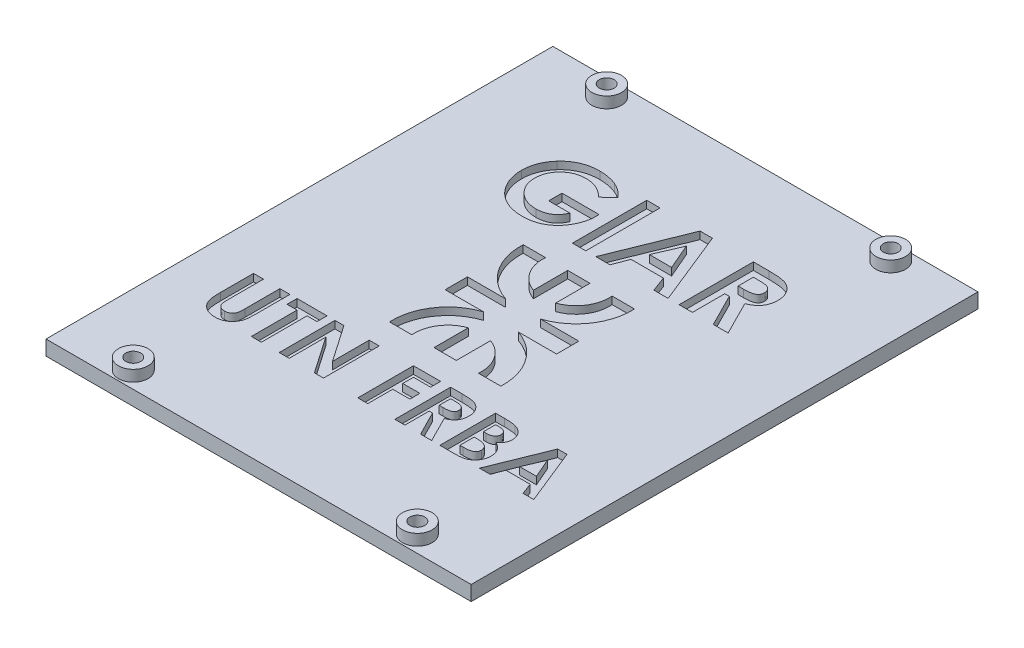
from build123d import *

# Parameters (mm, degrees)
SKETCH2_W           = 114.5
SKETCH2_H           = 136.5
SKETCH2_R           = 2
BOSS_EXTRUDE1_DEPTH = 4
CUT_EXTRUDE1_DEPTH  = 2
SKETCH4_W           = 3.58974359
SKETCH4_H           = 20
CUT_EXTRUDE2_DEPTH  = 2
SKETCH5_R           = 4
SKETCH5_R_2         = 2
BOSS_EXTRUDE2_DEPTH = 3


with BuildPart() as part:
    # Sketch2 → Boss-Extrude1 (new body)
    with BuildSketch(Plane(origin=(0, 0, 0), x_dir=(1, 0, 0), z_dir=(0, 1, 0))):
        Rectangle(SKETCH2_W, SKETCH2_H)
        with Locations((-38.25, 63.75)):
            Circle(SKETCH2_R, mode=Mode.SUBTRACT)
        with Locations((-38.25, -63.75)):
            Circle(SKETCH2_R, mode=Mode.SUBTRACT)
        with Locations((38.25, -63.75)):
            Circle(SKETCH2_R, mode=Mode.SUBTRACT)
        with Locations((38.25, 63.75)):
            Circle(SKETCH2_R, mode=Mode.SUBTRACT)
    extrude(amount=BOSS_EXTRUDE1_DEPTH)

    # Sketch3 → Cut-Extrude1 (cut)
    with BuildSketch(Plane(origin=(0, 4, 0), x_dir=(1, 0, 0), z_dir=(0, 1, 0))):
        with BuildLine():
            Line((-15, 3), (-15, -3))
            Line((-15, -3), (-4.683748499, -3))
            ThreePointArc((-4.683748499, -3), (-12.36640312, -8.760472694), (-14.981238267, -18))
            Line((-14.981238267, -18), (-8.968695557, -18))
            ThreePointArc((-8.968695557, -18), (-7.558771319, -12.364820766), (-3, -8.764718626))
            Line((-3, -8.764718626), (-3, -18))
            Line((-3, -18), (3, -18))
            Line((3, -18), (3, -8.764718626))
            ThreePointArc((3, -8.764718626), (7.558771319, -12.364820766), (8.968695557, -18))
            Line((8.968695557, -18), (14.981238267, -18))
            ThreePointArc((14.981238267, -18), (12.36640312, -8.760472694), (4.683748499, -3))
            Line((4.683748499, -3), (15, -3))
            Line((15, -3), (15, 3))
            Line((15, 3), (4.683748499, 3))
            ThreePointArc((4.683748499, 3), (12.36640312, 8.760472694), (14.981238267, 18))
            Line((14.981238267, 18), (8.968695557, 18))
            ThreePointArc((8.968695557, 18), (7.558771319, 12.364820766), (3, 8.764718626))
            Line((3, 8.764718626), (3, 18))
            Line((3, 18), (0, 18))
            Line((0, 18), (-3, 18))
            Line((-3, 18), (-3, 8.764718626))
            ThreePointArc((-3, 8.764718626), (-7.558771319, 12.364820766), (-8.968695557, 18))
            Line((-8.968695557, 18), (-14.981238267, 18))
            ThreePointArc((-14.981238267, 18), (-12.36640312, 8.760472694), (-4.683748499, 3))
            Line((-4.683748499, 3), (-15, 3))
        make_face()
    extrude(amount=-CUT_EXTRUDE1_DEPTH, mode=Mode.SUBTRACT)

    # Sketch4 → Cut-Extrude2 (cut)
    # profile 1 of 11: a face of its own
    with BuildSketch(Plane(origin=(0, 4, 4), x_dir=(1, 0, 0), z_dir=(0, 1, 0))):
        with BuildLine():
            Line((-13.209134615, 45.818910256), (-15.925480769, 43.21875))
            add(Edge.make_bspline(
                [(-15.925480769, 43.21875), (-16.140538634, 43.434065542), (-16.56251767, 43.856550183), (-17.252611595, 44.406442978), (-17.967339464, 44.873960563), (-18.709053733, 45.258386223), (-19.478787615, 45.556580188), (-20.275022094, 45.769887872), (-21.099052543, 45.896404274), (-21.656884374, 45.914116139), (-21.939102564, 45.923076923)],
                knots=[0, 0, 0, 0, 1.075575784, 2.110457258, 3.113929901, 4.09197124, 5.059417775, 6.02750972, 7.002078037, 8, 8, 8, 8], degree=3))
            add(Edge.make_bspline(
                [(-21.939102564, 45.923076923), (-22.183777106, 45.916798142), (-22.664217018, 45.904469206), (-23.370177196, 45.810844105), (-24.04476539, 45.654447585), (-24.691168634, 45.43778632), (-25.305440412, 45.155841537), (-25.891139928, 44.812964722), (-26.444662783, 44.40653284), (-26.961650383, 43.944250426), (-27.432369257, 43.439531365), (-27.843331689, 42.899303498), (-28.193383392, 42.333636215), (-28.481547336, 41.739635478), (-28.700808761, 41.11821296), (-28.857332726, 40.469819783), (-28.956686522, 39.796340266), (-28.968417237, 39.336885564), (-28.974358974, 39.104166667)],
                knots=[0, 0, 0, 0, 1.075001177, 2.110859044, 3.123021556, 4.114053297, 5.101481495, 6.087880186, 7.091499647, 8.114004866, 9.131394192, 10.11971144, 11.092043119, 12.050101265, 13.015322563, 13.981809771, 14.977764287, 16, 16, 16, 16], degree=3))
            add(Edge.make_bspline(
                [(-28.974358974, 39.104166667), (-28.968816806, 38.863393056), (-28.957897976, 38.389036082), (-28.853010267, 37.692896831), (-28.691412693, 37.023160707), (-28.454876933, 36.384796998), (-28.163773046, 35.769061012), (-27.794605356, 35.187880141), (-27.364118887, 34.632379115), (-26.873082857, 34.112229527), (-26.338962464, 33.632776788), (-25.760492701, 33.219188514), (-25.155274163, 32.862351109), (-24.513538596, 32.57974742), (-23.846424631, 32.352847616), (-23.147165815, 32.192863783), (-22.41733671, 32.094714256), (-21.919380892, 32.082912505), (-21.666666667, 32.076923077)],
                knots=[0, 0, 0, 0, 1.022067601, 2.013613092, 2.983553406, 3.943623673, 4.90013463, 5.87121881, 6.861774014, 7.881098904, 8.905697761, 9.905387765, 10.89678721, 11.884561068, 12.87834324, 13.885584958, 14.926927371, 16, 16, 16, 16], degree=3))
            add(Edge.make_bspline(
                [(-21.666666667, 32.076923077), (-21.502285422, 32.07840626), (-21.179568462, 32.08131808), (-20.706197677, 32.128585096), (-20.252822164, 32.19615879), (-19.817686125, 32.285618337), (-19.405183266, 32.412219649), (-19.009602202, 32.560264294), (-18.63326069, 32.734986493), (-18.278199215, 32.942414489), (-17.939133432, 33.174915917), (-17.619237062, 33.440946992), (-17.312898747, 33.734509694), (-17.02369801, 34.059190303), (-16.75652966, 34.417891852), (-16.502834297, 34.804022719), (-16.265516693, 35.221415018), (-16.125291982, 35.516156317), (-16.053685897, 35.666666667)],
                knots=[0, 0, 0, 0, 1.109579412, 2.178351274, 3.208885622, 4.204702371, 5.174744997, 6.119429583, 7.05542196, 7.97267548, 8.893247984, 9.828544973, 10.778894627, 11.756245826, 12.760884819, 13.796418446, 14.874735809, 16, 16, 16, 16], degree=3))
            Line((-16.053685897, 35.666666667), (-21.794871795, 35.666666667))
            Line((-21.794871795, 35.666666667), (-21.794871795, 39.256410256))
            Line((-21.794871795, 39.256410256), (-11.822916667, 39.256410256))
            Line((-11.822916667, 39.256410256), (-11.794871795, 38.403044872))
            add(Edge.make_bspline(
                [(-11.794871795, 38.403044872), (-11.798475352, 38.183878989), (-11.805676036, 37.745938343), (-11.871482733, 37.093919328), (-11.980490525, 36.450547993), (-12.129514611, 35.816470524), (-12.316279489, 35.188576544), (-12.554463172, 34.572878661), (-12.833374809, 33.965201415), (-13.14587551, 33.368126966), (-13.497036385, 32.795217798), (-13.875112629, 32.252748445), (-14.274714507, 31.741657803), (-14.704533196, 31.269066647), (-15.157875711, 30.831005), (-15.635634462, 30.42915814), (-16.139499256, 30.063186054), (-16.666800922, 29.729997114), (-17.22054295, 29.437976667), (-17.797680867, 29.183957618), (-18.397343275, 28.968224603), (-19.021078359, 28.791370462), (-19.667658767, 28.654913422), (-20.337098348, 28.56134465), (-21.029764767, 28.497763619), (-21.499585747, 28.490750183), (-21.738782051, 28.487179487)],
                knots=[0, 0, 0, 0, 1.006889344, 2.011981806, 3.007738725, 4.003571281, 5.003404394, 6.015442001, 7.03424805, 8.074616296, 9.110249922, 10.119753985, 11.111721717, 12.089233633, 13.052717867, 14.006597561, 14.955430184, 15.912305663, 16.870361111, 17.829300583, 18.807640451, 19.796414044, 20.806216501, 21.841577364, 22.90109906, 24, 24, 24, 24], degree=3))
            add(Edge.make_bspline(
                [(-21.738782051, 28.487179487), (-21.99398829, 28.490705616), (-22.499883174, 28.497695454), (-23.247916563, 28.563160047), (-23.974249037, 28.671205132), (-24.679061761, 28.820735838), (-25.363991169, 29.006838746), (-26.027860445, 29.240441918), (-26.669311799, 29.518320278), (-27.290266076, 29.833115501), (-27.882786803, 30.190120704), (-28.445546048, 30.583075759), (-28.975472162, 31.014508365), (-29.477993232, 31.47719625), (-29.941368425, 31.982512324), (-30.382865921, 32.514076841), (-30.781096678, 33.091385468), (-31.153183438, 33.695721691), (-31.483748288, 34.326832259), (-31.772832002, 34.973044458), (-32.019362429, 35.630616715), (-32.21375763, 36.302610909), (-32.371588328, 36.984341331), (-32.484519153, 37.678772671), (-32.548296467, 38.385818001), (-32.558810475, 38.860989088), (-32.564102564, 39.100160256)],
                knots=[0, 0, 0, 0, 1.084149091, 2.14910686, 3.187506334, 4.202448172, 5.208724393, 6.201130722, 7.189831603, 8.176984443, 9.156919086, 10.126598231, 11.090766514, 12.05840148, 13.026036446, 14.001772938, 14.991905635, 16.003017641, 17.015720547, 18.016462227, 19.009322657, 19.99686681, 20.986544154, 21.980959929, 22.983742515, 24, 24, 24, 24], degree=3))
            add(Edge.make_bspline(
                [(-32.564102564, 39.100160256), (-32.557015327, 39.42644084), (-32.543020135, 40.070748258), (-32.41340342, 41.019817171), (-32.211350272, 41.937946648), (-31.921383662, 42.821792922), (-31.549288027, 43.672573502), (-31.10033444, 44.492285636), (-30.564770654, 45.280058041), (-30.1502075, 45.76779857), (-29.939903846, 46.015224359)],
                knots=[0, 0, 0, 0, 1.034044851, 2.041932006, 3.031217818, 4.011390712, 4.986069675, 5.97149666, 6.970960976, 8, 8, 8, 8], degree=3))
            add(Edge.make_bspline(
                [(-29.939903846, 46.015224359), (-29.809328362, 46.158367677), (-29.550137991, 46.442505011), (-29.135822654, 46.837319617), (-28.711000164, 47.208459953), (-28.269786662, 47.548056221), (-27.814501525, 47.863542347), (-27.343834363, 48.149004292), (-26.860254187, 48.413531314), (-26.359989657, 48.643615663), (-25.845659727, 48.849905474), (-25.314986511, 49.02445566), (-24.771944641, 49.179065637), (-24.211725465, 49.296684175), (-23.639988532, 49.394627918), (-23.052675462, 49.460274943), (-22.451386719, 49.50838954), (-22.044705255, 49.511331839), (-21.838942308, 49.512820513)],
                knots=[0, 0, 0, 0, 1.020590567, 2.025856924, 3.013483481, 3.991664875, 4.957826714, 5.930500614, 6.890802512, 7.860442893, 8.829981142, 9.809047939, 10.802672283, 11.803273349, 12.823572789, 13.857849586, 14.916166035, 16, 16, 16, 16], degree=3))
            add(Edge.make_bspline(
                [(-21.838942308, 49.512820513), (-21.623853223, 49.509503469), (-21.195904924, 49.50290377), (-20.559616672, 49.457238161), (-19.932170072, 49.38678689), (-19.316209245, 49.28110596), (-18.709667024, 49.150779378), (-18.115683016, 48.983798769), (-17.530382211, 48.794078719), (-17.149353604, 48.642819879), (-16.959134615, 48.567307692)],
                knots=[0, 0, 0, 0, 1.03180557, 2.052914215, 3.058998889, 4.059601663, 5.049854447, 6.033765722, 7.018406786, 8, 8, 8, 8], degree=3))
            add(Edge.make_bspline(
                [(-16.959134615, 48.567307692), (-16.799088867, 48.497520839), (-16.473560242, 48.355576311), (-15.999956214, 48.095882139), (-15.525195042, 47.807981343), (-15.05439964, 47.481347603), (-14.588287368, 47.116591875), (-14.121991519, 46.719475414), (-13.660272207, 46.285367615), (-13.36146133, 45.976409693), (-13.209134615, 45.818910256)],
                knots=[0, 0, 0, 0, 0.894392155, 1.819168899, 2.76525314, 3.739198753, 4.75366411, 5.797420238, 6.877176959, 8, 8, 8, 8], degree=3))
        make_face()
    # profile 2 of 11: a face of its own
    with BuildSketch(Plane(origin=(0, 4, 4), x_dir=(1, 0, 0), z_dir=(0, 1, 0))):
        with Locations((-6.923076923, 39)):
            Rectangle(SKETCH4_W, SKETCH4_H)
    # profile 3 of 11: a face of its own
    with BuildSketch(Plane(origin=(0, 4, 4), x_dir=(1, 0, 0), z_dir=(0, 1, 0))):
        Polygon((5.645032051, 49), (8.974358974, 49), (17.051282051, 29), (13.217147436, 29), (11.662660256, 33.102564103), (2.948717949, 33.102564103), (1.394230769, 29), (-2.435897436, 29), align=None)
        Polygon((7.307692308, 43.635416667), (4.310897436, 36.692307692), (10.304487179, 36.692307692), align=None, mode=Mode.SUBTRACT)
    # profile 4 of 11: a face of its own
    with BuildSketch(Plane(origin=(0, 4, 4), x_dir=(1, 0, 0), z_dir=(0, 1, 0))):
        with BuildLine():
            Line((20, 49), (24.182692308, 49))
            add(Edge.make_bspline(
                [(24.182692308, 49), (24.459166996, 48.999018674), (24.990905701, 48.997131306), (25.757643869, 48.967353651), (26.461998321, 48.925915599), (27.105011916, 48.862680033), (27.686409563, 48.778837315), (28.206773958, 48.680000625), (28.666089891, 48.567355027), (29.068231057, 48.426989724), (29.431143575, 48.26865979), (29.769428495, 48.086735793), (30.090548888, 47.883243514), (30.392358409, 47.65282852), (30.677479855, 47.399635921), (30.946451123, 47.123410852), (31.195471402, 46.821811039), (31.422998747, 46.496742211), (31.630371606, 46.154777258), (31.813645721, 45.79544666), (31.962684536, 45.418500527), (32.094376305, 45.029386545), (32.18922962, 44.622542253), (32.255198713, 44.201928349), (32.303498702, 43.766064229), (32.306275721, 43.469957497), (32.307692308, 43.318910256)],
                knots=[0, 0, 0, 0, 1.749336639, 3.364467119, 4.854658419, 6.213483162, 7.451590619, 8.570285859, 9.5643256, 10.440900261, 11.26203566, 12.067320669, 12.869050712, 13.665104639, 14.467235401, 15.27997916, 16.102287765, 16.939272006, 17.78853747, 18.631303466, 19.488103222, 20.351255419, 21.228522269, 22.127379805, 23.044756219, 24, 24, 24, 24], degree=3))
            add(Edge.make_bspline(
                [(32.307692308, 43.318910256), (32.304012524, 43.161251636), (32.296797138, 42.852111816), (32.257931147, 42.398010633), (32.186896323, 41.963558385), (32.079303748, 41.550027093), (31.955640059, 41.15226988), (31.791199073, 40.777625613), (31.605611168, 40.420645635), (31.385193836, 40.086379564), (31.143296581, 39.767402681), (30.861975163, 39.475936175), (30.559454887, 39.196314824), (30.218729988, 38.946053162), (29.854819935, 38.708229398), (29.460494218, 38.492697733), (29.038326343, 38.294040198), (28.741521419, 38.183255033), (28.58974359, 38.126602564)],
                knots=[0, 0, 0, 0, 1.099860209, 2.156625411, 3.176576793, 4.16617041, 5.135385252, 6.078461593, 7.016046972, 7.938469504, 8.868247731, 9.803980173, 10.76021508, 11.73834243, 12.748633912, 13.790971185, 14.870363756, 16, 16, 16, 16], degree=3))
            Line((28.58974359, 38.126602564), (33.205128205, 29))
            Line((33.205128205, 29), (29.21474359, 29))
            Line((29.21474359, 29), (24.807692308, 37.717948718))
            Line((24.807692308, 37.717948718), (23.58974359, 37.717948718))
            Line((23.58974359, 37.717948718), (23.58974359, 29))
            Line((23.58974359, 29), (20, 29))
            Line((20, 29), (20, 49))
        make_face()
        with BuildLine():
            Line((23.58974359, 41.307692308), (24.987980769, 41.307692308))
            add(Edge.make_bspline(
                [(24.987980769, 41.307692308), (25.158926887, 41.309617618), (25.486251972, 41.313304173), (25.956988434, 41.330403944), (26.384529407, 41.371605941), (26.770710895, 41.423663125), (27.117476128, 41.483770662), (27.421732084, 41.569908412), (27.688166881, 41.662207191), (27.913623258, 41.776910631), (28.106248006, 41.907353321), (28.272567146, 42.055539459), (28.410136923, 42.227046045), (28.523363867, 42.41721227), (28.611442118, 42.627720107), (28.675732495, 42.856258656), (28.711661308, 43.105431267), (28.71579504, 43.277394297), (28.717948718, 43.366987179)],
                knots=[0, 0, 0, 0, 1.688639943, 3.233382647, 4.650958383, 5.928841754, 7.082724185, 8.122798841, 9.049171256, 9.863274652, 10.613301712, 11.341792392, 12.054588806, 12.776240173, 13.521029143, 14.301969904, 15.115324896, 16, 16, 16, 16], degree=3))
            add(Edge.make_bspline(
                [(28.717948718, 43.366987179), (28.713876992, 43.4729821), (28.705878842, 43.68118948), (28.626512342, 43.980935101), (28.500178018, 44.258370181), (28.327008262, 44.5122412), (28.108923468, 44.73480206), (27.858653961, 44.930991231), (27.57079832, 45.086122947), (27.304265658, 45.188446176), (27.061783235, 45.249667219), (26.842950499, 45.295288599), (26.589540873, 45.327621781), (26.301363046, 45.361916875), (25.979151595, 45.384155508), (25.621150273, 45.400385277), (25.228387258, 45.407025673), (24.954594133, 45.40914849), (24.811698718, 45.41025641)],
                knots=[0, 0, 0, 0, 1.020303359, 2.004196876, 2.966617323, 3.9489082, 4.950758222, 5.960522915, 7.003732012, 8.091992268, 8.70421221, 9.413913587, 10.24622431, 11.166358409, 12.212345909, 13.359657661, 14.621978493, 16, 16, 16, 16], degree=3))
            Line((24.811698718, 45.41025641), (23.58974359, 45.41025641))
            Line((23.58974359, 45.41025641), (23.58974359, 41.307692308))
        make_face(mode=Mode.SUBTRACT)
    # profile 5 of 11: a face of its own
    with BuildSketch(Plane(origin=(0, 4, 4), x_dir=(1, 0, 0), z_dir=(0, 1, 0))):
        with BuildLine():
            Line((-44.615384615, -21), (-41.923076923, -21))
            Line((-41.923076923, -21), (-41.923076923, -30.759615385))
            add(Edge.make_bspline(
                [(-41.923076923, -30.759615385), (-41.922930529, -30.860798844), (-41.922647769, -31.05623365), (-41.908492692, -31.336618611), (-41.895539819, -31.594351096), (-41.872169161, -31.829148944), (-41.837642689, -32.041112593), (-41.804209797, -32.231603621), (-41.758961684, -32.397211503), (-41.690961005, -32.58571663), (-41.586194281, -32.797512436), (-41.415011267, -33.018250884), (-41.217480713, -33.219706757), (-40.980728967, -33.387390993), (-40.714640942, -33.523032425), (-40.420678674, -33.623527716), (-40.099256544, -33.679389754), (-39.877010773, -33.687918117), (-39.762620192, -33.692307692)],
                knots=[0, 0, 0, 0, 1.155499968, 2.231836252, 3.205919964, 4.102923608, 4.924856345, 5.658536265, 6.31071849, 6.882491295, 7.94666036, 8.992281882, 10.060072772, 11.158554251, 12.289267114, 13.461410017, 14.693379945, 16, 16, 16, 16], degree=3))
            add(Edge.make_bspline(
                [(-39.762620192, -33.692307692), (-39.641094317, -33.688761479), (-39.404139435, -33.681846965), (-39.063317559, -33.613973516), (-38.747544159, -33.505895741), (-38.463505233, -33.351641212), (-38.211483447, -33.166740125), (-37.998152286, -32.955894944), (-37.829792117, -32.718685137), (-37.720061222, -32.499841026), (-37.658452729, -32.29841408), (-37.612274094, -32.118446747), (-37.578420046, -31.906103108), (-37.547706541, -31.664699367), (-37.529250091, -31.391735046), (-37.509237079, -31.08940536), (-37.501902125, -30.755641688), (-37.500651935, -30.523235779), (-37.5, -30.402043269)],
                knots=[0, 0, 0, 0, 1.261321664, 2.459363699, 3.594844139, 4.716940403, 5.803436589, 6.833651888, 7.818396249, 8.814403945, 9.360733334, 10.004355033, 10.743453831, 11.592799886, 12.532235708, 13.585170094, 14.740740724, 16, 16, 16, 16], degree=3))
            Line((-37.5, -30.402043269), (-37.5, -21))
            Line((-37.5, -21), (-34.807692308, -21))
            Line((-34.807692308, -21), (-34.807692308, -29.948317308))
            add(Edge.make_bspline(
                [(-34.807692308, -29.948317308), (-34.808066184, -30.129609789), (-34.80878511, -30.478217549), (-34.819825659, -30.979191432), (-34.843328989, -31.436750715), (-34.863069076, -31.851029095), (-34.901272904, -32.22146847), (-34.94107233, -32.549650723), (-34.991800123, -32.834412849), (-35.067280028, -33.158579924), (-35.197535999, -33.531846438), (-35.407525702, -33.961646649), (-35.674094038, -34.382447089), (-35.989164489, -34.789618665), (-36.344907848, -35.167867936), (-36.733436525, -35.499921837), (-37.148577763, -35.78080363), (-37.594669492, -36.003645418), (-38.071332064, -36.177445213), (-38.5832817, -36.294229921), (-39.130169291, -36.373131136), (-39.507914887, -36.380710569), (-39.702524038, -36.384615385)],
                knots=[0, 0, 0, 0, 1.170808336, 2.251350247, 3.235597562, 4.129743112, 4.929140599, 5.639994148, 6.264258765, 6.79612947, 7.788252245, 8.809469599, 9.879094798, 10.999557536, 12.129761673, 13.226370002, 14.293821979, 15.358369427, 16.438775801, 17.562147481, 18.744053101, 20, 20, 20, 20], degree=3))
            add(Edge.make_bspline(
                [(-39.702524038, -36.384615385), (-39.83182623, -36.38243746), (-40.086936802, -36.378140459), (-40.462121652, -36.340252138), (-40.824811509, -36.284418998), (-41.174324884, -36.202964198), (-41.51187487, -36.097739809), (-41.837371789, -35.968215915), (-42.149606016, -35.815114982), (-42.446830332, -35.63984521), (-42.728678977, -35.450321122), (-42.98627409, -35.240225693), (-43.228480123, -35.025096273), (-43.448299844, -34.795879302), (-43.647384297, -34.554981168), (-43.825323466, -34.301855917), (-43.981852993, -34.036526032), (-44.120910292, -33.754208959), (-44.239929768, -33.440555538), (-44.340267658, -33.084408988), (-44.427925199, -32.680187069), (-44.493067112, -32.22697909), (-44.552125152, -31.726278773), (-44.589505635, -31.176781719), (-44.609061049, -30.57847216), (-44.613223498, -30.163676547), (-44.615384615, -29.948317308)],
                knots=[0, 0, 0, 0, 1.001158378, 1.975264943, 2.917723546, 3.841610987, 4.75185031, 5.653588123, 6.552117133, 7.442167995, 8.324307438, 9.179605724, 10.014504199, 10.831958861, 11.636465792, 12.43274043, 13.225645099, 14.020104002, 14.867201867, 15.819789774, 16.883317127, 18.068162734, 19.364263498, 20.787406516, 22.332041935, 24, 24, 24, 24], degree=3))
            Line((-44.615384615, -29.948317308), (-44.615384615, -21))
        make_face()
    # profile 6 of 11: a face of its own
    with BuildSketch(Plane(origin=(0, 4, 4), x_dir=(1, 0, 0), z_dir=(0, 1, 0))):
        Polygon((-32.884615385, -21), (-24.807692308, -21), (-24.807692308, -23.692307692), (-27.5, -23.692307692), (-27.5, -36), (-30.192307692, -36), (-30.192307692, -23.692307692), (-32.884615385, -23.692307692), align=None)
    # profile 7 of 11: a face of its own
    with BuildSketch(Plane(origin=(0, 4, 4), x_dir=(1, 0, 0), z_dir=(0, 1, 0))):
        Polygon((-22.692307692, -21), (-20.267427885, -21), (-13.461538462, -30.870793269), (-13.461538462, -21), (-10.769230769, -21), (-10.769230769, -36), (-13.212139423, -36), (-20, -26.159254808), (-20, -36), (-22.692307692, -36), align=None)
    # profile 8 of 11: a face of its own
    with BuildSketch(Plane(origin=(0, 4, 4), x_dir=(1, 0, 0), z_dir=(0, 1, 0))):
        Polygon((-1.538461538, -21), (5.769230769, -21), (5.769230769, -23.692307692), (1.153846154, -23.692307692), (1.153846154, -26.576923077), (5.769230769, -26.576923077), (5.769230769, -29.269230769), (1.153846154, -29.269230769), (1.153846154, -36), (-1.538461538, -36), align=None)
    # profile 9 of 11: a face of its own
    with BuildSketch(Plane(origin=(0, 4, 4), x_dir=(1, 0, 0), z_dir=(0, 1, 0))):
        with BuildLine():
            Line((8.461538462, -21), (11.598557692, -21))
            add(Edge.make_bspline(
                [(11.598557692, -21), (11.805913709, -21.000735995), (12.204717737, -21.00215152), (12.779771364, -21.024484762), (13.308037202, -21.055563301), (13.790297399, -21.102989976), (14.226345634, -21.165872014), (14.61661893, -21.239999531), (14.961105879, -21.32448373), (15.262711754, -21.429757707), (15.534896143, -21.548505157), (15.788609833, -21.684948155), (16.029450127, -21.837567365), (16.255807268, -22.01037861), (16.469648353, -22.20027306), (16.671376804, -22.407441861), (16.858142013, -22.63364172), (17.028787521, -22.877443342), (17.184317166, -23.133917056), (17.321772752, -23.403415005), (17.433551863, -23.686124605), (17.53232069, -23.977960092), (17.603460676, -24.28309331), (17.652937496, -24.598553738), (17.689162488, -24.925451828), (17.691245252, -25.147531877), (17.692307692, -25.260817308)],
                knots=[0, 0, 0, 0, 1.749336639, 3.364467119, 4.854658419, 6.213483162, 7.451590619, 8.570285859, 9.5643256, 10.440900261, 11.26203566, 12.067320669, 12.869050712, 13.665104639, 14.467235401, 15.27997916, 16.102287765, 16.939272006, 17.78853747, 18.631303466, 19.488103222, 20.351255419, 21.228522269, 22.127379805, 23.044756219, 24, 24, 24, 24], degree=3))
            add(Edge.make_bspline(
                [(17.692307692, -25.260817308), (17.689547854, -25.379061273), (17.684136315, -25.610916138), (17.654986822, -25.951492025), (17.601710704, -26.277331211), (17.521016273, -26.58747968), (17.428268506, -26.88579759), (17.304937766, -27.16678079), (17.165746838, -27.434515774), (17.000433838, -27.685215327), (16.819010897, -27.924447989), (16.608019834, -28.143047869), (16.381129627, -28.352763882), (16.125585952, -28.540460129), (15.852653413, -28.718827951), (15.556909125, -28.8804767), (15.240283219, -29.029469852), (15.017679526, -29.112558725), (14.903846154, -29.155048077)],
                knots=[0, 0, 0, 0, 1.099860209, 2.156625411, 3.176576793, 4.16617041, 5.135385252, 6.078461593, 7.016046972, 7.938469504, 8.868247731, 9.803980173, 10.76021508, 11.73834243, 12.748633912, 13.790971185, 14.870363756, 16, 16, 16, 16], degree=3))
            Line((14.903846154, -29.155048077), (18.365384615, -36))
            Line((18.365384615, -36), (15.372596154, -36))
            Line((15.372596154, -36), (12.067307692, -29.461538462))
            Line((12.067307692, -29.461538462), (11.153846154, -29.461538462))
            Line((11.153846154, -29.461538462), (11.153846154, -36))
            Line((11.153846154, -36), (8.461538462, -36))
            Line((8.461538462, -36), (8.461538462, -21))
        make_face()
        with BuildLine():
            Line((11.153846154, -26.769230769), (12.202524038, -26.769230769))
            add(Edge.make_bspline(
                [(12.202524038, -26.769230769), (12.330733627, -26.767786787), (12.57622744, -26.76502187), (12.929279787, -26.752197042), (13.249935517, -26.721295544), (13.539571633, -26.682252656), (13.799645558, -26.637172003), (14.027837524, -26.572568691), (14.227663622, -26.503344607), (14.396755905, -26.417317026), (14.541224466, -26.319485009), (14.665963821, -26.208345406), (14.769141154, -26.079715466), (14.854061362, -25.937090798), (14.92012005, -25.77920992), (14.968337832, -25.607806008), (14.995284442, -25.42092655), (14.998384741, -25.291954277), (15, -25.224759615)],
                knots=[0, 0, 0, 0, 1.688639943, 3.233382647, 4.650958383, 5.928841754, 7.082724185, 8.122798841, 9.049171256, 9.863274652, 10.613301712, 11.341792392, 12.054588806, 12.776240173, 13.521029143, 14.301969904, 15.115324896, 16, 16, 16, 16], degree=3))
            add(Edge.make_bspline(
                [(15, -25.224759615), (14.996946206, -25.145263425), (14.990947593, -24.98910789), (14.931422718, -24.764298675), (14.836671975, -24.556222365), (14.706794658, -24.3658191), (14.543231063, -24.198898455), (14.355528932, -24.051756577), (14.139637202, -23.935407789), (13.939737705, -23.858665368), (13.757875888, -23.812749586), (13.593751336, -23.778533551), (13.403694116, -23.754283665), (13.187560746, -23.728562344), (12.945902158, -23.711883369), (12.677401166, -23.699711042), (12.382828905, -23.694730746), (12.177484061, -23.693138632), (12.0703125, -23.692307692)],
                knots=[0, 0, 0, 0, 1.020303359, 2.004196876, 2.966617323, 3.9489082, 4.950758222, 5.960522915, 7.003732012, 8.091992268, 8.70421221, 9.413913587, 10.24622431, 11.166358409, 12.212345909, 13.359657661, 14.621978493, 16, 16, 16, 16], degree=3))
            Line((12.0703125, -23.692307692), (11.153846154, -23.692307692))
            Line((11.153846154, -23.692307692), (11.153846154, -26.769230769))
        make_face(mode=Mode.SUBTRACT)
    # profile 10 of 11: a face of its own
    with BuildSketch(Plane(origin=(0, 4, 4), x_dir=(1, 0, 0), z_dir=(0, 1, 0))):
        with BuildLine():
            Line((20.576923077, -36), (20.576923077, -21))
            Line((20.576923077, -21), (22.980769231, -21))
            add(Edge.make_bspline(
                [(22.980769231, -21), (23.149053492, -20.999980795), (23.474680347, -20.999943633), (23.944474919, -21.016441275), (24.380169708, -21.037782825), (24.780378166, -21.061659056), (25.145781476, -21.102802572), (25.47582398, -21.146163344), (25.771165108, -21.198453762), (25.953758479, -21.245359888), (26.039663462, -21.267427885)],
                knots=[0, 0, 0, 0, 1.311965854, 2.538629056, 3.664479157, 4.713267157, 5.663616078, 6.530575999, 7.308677837, 8, 8, 8, 8], degree=3))
            add(Edge.make_bspline(
                [(26.039663462, -21.267427885), (26.152465426, -21.298555187), (26.373819093, -21.359636947), (26.690868184, -21.482994202), (26.991633472, -21.620114536), (27.275747731, -21.776543192), (27.541466388, -21.954168702), (27.78777962, -22.154400755), (28.019999794, -22.369202046), (28.229881302, -22.604559024), (28.419579605, -22.85325727), (28.584393419, -23.115231616), (28.7275955, -23.386476304), (28.842194673, -23.670404769), (28.928542997, -23.965709443), (28.991697801, -24.271129329), (29.032630666, -24.587630851), (29.036498285, -24.802957181), (29.038461538, -24.912259615)],
                knots=[0, 0, 0, 0, 1.099996261, 2.158545794, 3.195537121, 4.207578794, 5.205712374, 6.197378256, 7.190519799, 8.17788031, 9.159561366, 10.129234751, 11.085776129, 12.040971148, 13.00380137, 13.975669004, 14.972423361, 16, 16, 16, 16], degree=3))
            add(Edge.make_bspline(
                [(29.038461538, -24.912259615), (29.033328214, -25.052684554), (29.023223895, -25.329093792), (28.95867682, -25.735088953), (28.837640998, -26.118812736), (28.679268568, -26.487337025), (28.463931577, -26.839287221), (28.190495245, -27.174495982), (27.863388345, -27.503284889), (27.612479295, -27.70037166), (27.481971154, -27.802884615)],
                knots=[0, 0, 0, 0, 0.986156485, 1.941127874, 2.875419072, 3.804401753, 4.751181392, 5.761612777, 6.835722519, 8, 8, 8, 8], degree=3))
            add(Edge.make_bspline(
                [(27.481971154, -27.802884615), (27.587728691, -27.856872921), (27.795089961, -27.962729051), (28.089482045, -28.136724929), (28.36205698, -28.321791613), (28.614036909, -28.514205486), (28.840136263, -28.722123251), (29.049691067, -28.933564402), (29.232362972, -29.160643636), (29.395713695, -29.395267418), (29.537695488, -29.640833127), (29.661345974, -29.896926058), (29.765789104, -30.16442108), (29.854234248, -30.441956859), (29.92019666, -30.73048799), (29.963205555, -31.030117663), (29.996135853, -31.339823988), (29.998697521, -31.550788203), (30, -31.658052885)],
                knots=[0, 0, 0, 0, 1.164658916, 2.283573913, 3.35186032, 4.395461096, 5.390182219, 6.362969632, 7.312859996, 8.245001507, 9.165155236, 10.092416118, 11.032087915, 11.979892451, 12.947605196, 13.931445124, 14.948243989, 16, 16, 16, 16], degree=3))
            add(Edge.make_bspline(
                [(30, -31.658052885), (29.991547781, -31.862922294), (29.974867362, -32.267231252), (29.852908273, -32.860849658), (29.641469964, -33.423653748), (29.357551916, -33.953406698), (29.007710255, -34.434773029), (28.605492667, -34.856445757), (28.154948562, -35.213382359), (27.73926717, -35.454286875), (27.379735501, -35.615956333), (27.081942137, -35.715910587), (26.762118377, -35.808508057), (26.414405816, -35.873531912), (26.04510801, -35.933048895), (25.650624281, -35.969795913), (25.231691913, -35.994698461), (24.943951054, -35.998197093), (24.795673077, -36)],
                knots=[0, 0, 0, 0, 1.284142165, 2.534249414, 3.780121997, 5.041676246, 6.291546858, 7.49970053, 8.684500223, 9.883330709, 10.50184324, 11.153274765, 11.851151195, 12.587658647, 13.369265475, 14.195992086, 15.070362669, 16, 16, 16, 16], degree=3))
            Line((24.795673077, -36), (20.576923077, -36))
        make_face()
        with BuildLine():
            Line((23.269230769, -23.692307692), (23.269230769, -26.961538462))
            Line((23.269230769, -26.961538462), (23.984375, -26.961538462))
            add(Edge.make_bspline(
                [(23.984375, -26.961538462), (24.081569526, -26.960690888), (24.269197677, -26.9590547), (24.540206639, -26.937981161), (24.792201206, -26.902028394), (25.02422562, -26.851865239), (25.23844127, -26.788165347), (25.433479686, -26.711520659), (25.608483319, -26.618005808), (25.811797064, -26.478711311), (26.026714355, -26.273733222), (26.215903628, -25.977599904), (26.327334847, -25.637047714), (26.33974528, -25.39686394), (26.346153846, -25.272836538)],
                knots=[0, 0, 0, 0, 1.065314748, 2.056525647, 2.977365736, 3.853934255, 4.656397591, 5.425096493, 6.14721249, 6.826394842, 8.123232004, 9.372140726, 10.643011755, 12, 12, 12, 12], degree=3))
            add(Edge.make_bspline(
                [(26.346153846, -25.272836538), (26.34102582, -25.15666427), (26.331110987, -24.932049857), (26.218914076, -24.616671218), (26.044650093, -24.337181197), (25.838906968, -24.145893135), (25.645159836, -24.015249028), (25.479261652, -23.929225447), (25.297175938, -23.852218016), (25.09537771, -23.793336258), (24.875019345, -23.749153459), (24.637171248, -23.716706485), (24.381423048, -23.694621695), (24.204777223, -23.693095571), (24.113581731, -23.692307692)],
                knots=[0, 0, 0, 0, 1.347982417, 2.606269829, 3.849316587, 5.153353503, 5.842674298, 6.568177932, 7.326619318, 8.142485038, 9.012069166, 9.942760135, 10.937925643, 12, 12, 12, 12], degree=3))
            Line((24.113581731, -23.692307692), (23.269230769, -23.692307692))
        make_face(mode=Mode.SUBTRACT)
        with BuildLine():
            Line((23.269230769, -29.461538462), (23.269230769, -33.307692308))
            Line((23.269230769, -33.307692308), (24.044471154, -33.307692308))
            add(Edge.make_bspline(
                [(24.044471154, -33.307692308), (24.197737165, -33.306816705), (24.492410196, -33.305133249), (24.914528792, -33.284793096), (25.298340125, -33.248133554), (25.64282724, -33.20236707), (25.948517785, -33.140360642), (26.214378452, -33.061527415), (26.444055176, -32.974797135), (26.636170804, -32.867674941), (26.793118266, -32.743011272), (26.934746895, -32.615602007), (27.050222054, -32.468623383), (27.141588155, -32.308384785), (27.220665354, -32.138866655), (27.268359136, -31.953449371), (27.304671508, -31.757628257), (27.306669875, -31.622183028), (27.307692308, -31.552884615)],
                knots=[0, 0, 0, 0, 1.753078804, 3.370512758, 4.83203934, 6.162291463, 7.344201807, 8.395507345, 9.331626367, 10.147333109, 10.898971645, 11.62040215, 12.321813352, 13.025280112, 13.727906689, 14.453419512, 15.208716525, 16, 16, 16, 16], degree=3))
            add(Edge.make_bspline(
                [(27.307692308, -31.552884615), (27.30543755, -31.473640791), (27.301045888, -31.319295139), (27.26517913, -31.093702497), (27.199997516, -30.883096797), (27.117898093, -30.682092567), (27.003652383, -30.497886461), (26.867875261, -30.324103801), (26.703821836, -30.166629407), (26.519334189, -30.015938637), (26.304147615, -29.884000704), (26.058161153, -29.769521177), (25.780038471, -29.673912092), (25.468918056, -29.597788076), (25.126163834, -29.533182675), (24.749274077, -29.494606119), (24.341387653, -29.465915039), (24.058552568, -29.46303047), (23.912259615, -29.461538462)],
                knots=[0, 0, 0, 0, 0.845221588, 1.646264278, 2.427170338, 3.19324141, 3.95557735, 4.731569926, 5.540061037, 6.376114724, 7.268642756, 8.224665384, 9.265483498, 10.400594375, 11.639216012, 12.983232105, 14.439614077, 16, 16, 16, 16], degree=3))
            Line((23.912259615, -29.461538462), (23.269230769, -29.461538462))
        make_face(mode=Mode.SUBTRACT)
    # profile 11 of 11: a face of its own
    with BuildSketch(Plane(origin=(0, 4, 4), x_dir=(1, 0, 0), z_dir=(0, 1, 0))):
        Polygon((37.310697115, -21), (39.807692308, -21), (45.865384615, -36), (42.989783654, -36), (41.823918269, -32.923076923), (35.288461538, -32.923076923), (34.122596154, -36), (31.25, -36), align=None)
        Polygon((38.557692308, -25.0234375), (36.310096154, -30.230769231), (40.805288462, -30.230769231), align=None, mode=Mode.SUBTRACT)
    extrude(amount=-CUT_EXTRUDE2_DEPTH, mode=Mode.SUBTRACT)

    # Sketch5 → Boss-Extrude2 (add)
    # profile 1 of 4: a face of its own
    with BuildSketch(Plane(origin=(0, 4, 0), x_dir=(1, 0, 0), z_dir=(0, 1, 0))):
        with Locations((38.25, -63.75)):
            Circle(SKETCH5_R)
        with Locations((38.25, -63.75)):
            Circle(SKETCH5_R_2, mode=Mode.SUBTRACT)
    # profile 2 of 4: a face of its own
    with BuildSketch(Plane(origin=(0, 4, 0), x_dir=(1, 0, 0), z_dir=(0, 1, 0))):
        with Locations((-38.25, -63.75)):
            Circle(SKETCH5_R)
        with Locations((-38.25, -63.75)):
            Circle(SKETCH5_R_2, mode=Mode.SUBTRACT)
    # profile 3 of 4: a face of its own
    with BuildSketch(Plane(origin=(0, 4, 0), x_dir=(1, 0, 0), z_dir=(0, 1, 0))):
        with Locations((38.25, 63.75)):
            Circle(SKETCH5_R)
        with Locations((38.25, 63.75)):
            Circle(SKETCH5_R_2, mode=Mode.SUBTRACT)
    # profile 4 of 4: a face of its own
    with BuildSketch(Plane(origin=(0, 4, 0), x_dir=(1, 0, 0), z_dir=(0, 1, 0))):
        with Locations((-38.25, 63.75)):
            Circle(SKETCH5_R)
        with Locations((-38.25, 63.75)):
            Circle(SKETCH5_R_2, mode=Mode.SUBTRACT)
    extrude(amount=BOSS_EXTRUDE2_DEPTH)


solid = part.part
